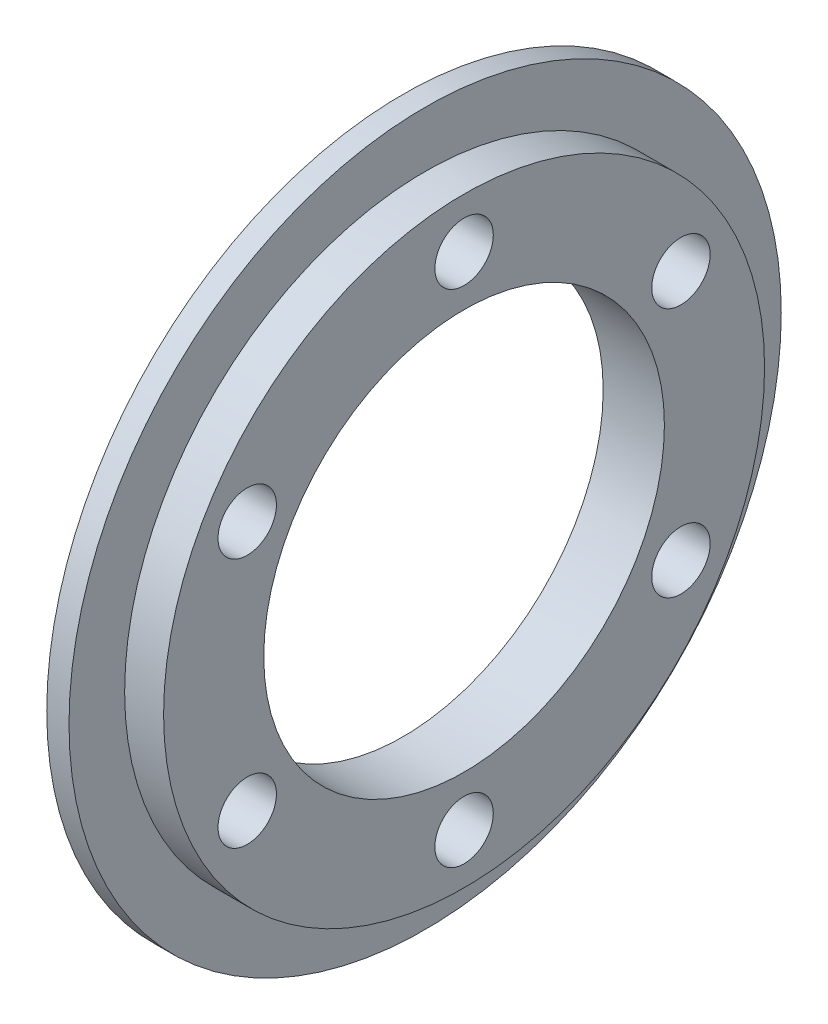
from build123d import *

# Parameters (mm, degrees)
M10_CLEARANCE_HOLE1_D = 10.5


with BuildPart() as part:
    # Sketch1 → Revolve1 (revolve)
    with BuildSketch(Plane(origin=(0, 0, 0), x_dir=(1, 0, 0), z_dir=(0, 1, 0))):
        Polygon((0, 54), (0, 36), (11, 36), (11, 54), (4, 54), (4, 64), (0, 64), align=None)
    revolve(axis=Axis((-0.5, 0, 0), (1, 0, 0)))

    # M10 Clearance Hole1 (through all)
    with Locations(Plane(origin=(11, 0, 0), x_dir=(0, 0, -1), z_dir=(1, 0, 0))):
        with Locations((-38.97114317, 22.5), (0, 45), (38.97114317, 22.5), (38.97114317, -22.5), (0, -45), (-38.97114317, -22.5)):
            Hole(M10_CLEARANCE_HOLE1_D / 2)


solid = part.part
